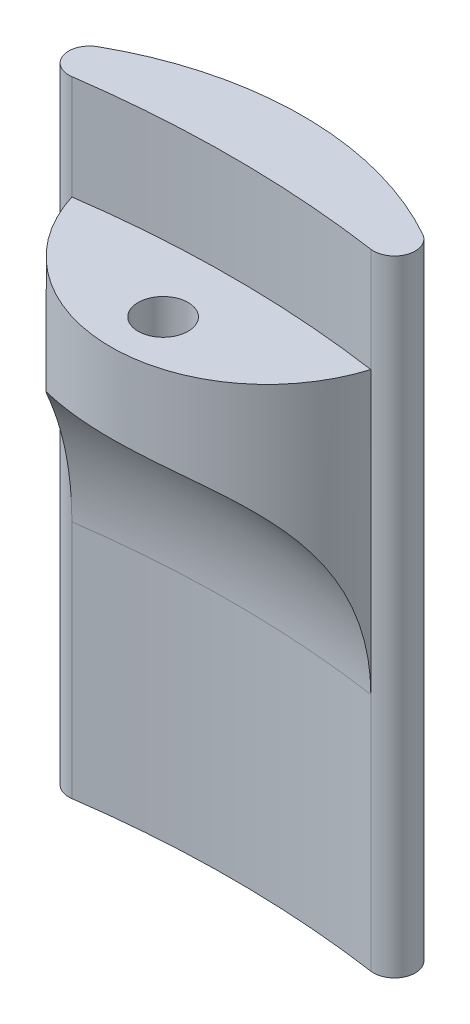
from build123d import *

# Parameters (mm, degrees)
BOSS_EXTRUDE1_DEPTH      = 10
BOSS_EXTRUDE1_DEPTH_BACK = 50
FILLET1_R                = 2
BOSS_EXTRUDE2_START      = -5
SKETCH3_R                = 2.4
BOSS_EXTRUDE2_DEPTH      = 5
FILLET2_R                = 22


with BuildPart() as part:
    # Sketch2 → Boss-Extrude1 (new, two sides: drawn at the far end of the back side and taken through both)
    with BuildSketch(Plane(origin=(0, 0, 0), x_dir=(1, 0, 0), z_dir=(0, 1, 0)).offset(-BOSS_EXTRUDE1_DEPTH_BACK)):
        with BuildLine():
            ThreePointArc((-22.5, 98.49115601), (0, 101.0285), (22.5, 98.49115601))
            ThreePointArc((22.5, 98.49115601), (0, 107.821909931), (-22.5, 98.49115601))
        make_face()
    extrude(amount=BOSS_EXTRUDE1_DEPTH + BOSS_EXTRUDE1_DEPTH_BACK)

    # Fillet1
    fillet1_edges = [part.edges().sort_by_distance(p)[0] for p in [
        (22.5, -20, -98.49115601),
        (-22.5, -20, -98.49115601),
    ]]
    fillet(fillet1_edges, radius=FILLET1_R)

    # Sketch3 → Boss-Extrude2 (add)
    with BuildSketch(Plane(origin=(0, 0, 0), x_dir=(1, 0, 0), z_dir=(0, 1, 0)).offset(BOSS_EXTRUDE2_START)):
        with BuildLine():
            ThreePointArc((14.341382747, 100.005412619), (0, 101.0285), (-14.341382747, 100.005412619))
            ThreePointArc((-14.341382747, 100.005412619), (0, 89.401404079), (14.341382747, 100.005412619))
        make_face()
        with Locations(Location((0, 94.415, 0), (0, 0, 270))):
            Circle(SKETCH3_R, mode=Mode.SUBTRACT)
    extrude(amount=BOSS_EXTRUDE2_DEPTH)

    # Fillet2
    # the kernel refuses this fillet: 22 mm, written as the material it adds along each edge
    with BuildSketch(Plane(origin=(0, -5, 0), x_dir=(0.6340991791841111, 0, -0.7732517254801548), z_dir=(0.7732517254801548, 0, 0.6340991791841111))) as fillet2_piece_1_section:
        with BuildLine():
            CenterArc((101.0285 - FILLET2_R, -FILLET2_R), FILLET2_R, 0, 90)
            Line((101.0285 - FILLET2_R, 0), (101.0285, 0))
            Line((101.0285, 0), (101.0285, -FILLET2_R))
        make_face()
    fillet2_piece_1 = revolve(axis=Axis((0, -5, 0), (0, 1, 0)), revolution_arc=78.706408495, mode=Mode.PRIVATE)
    fillet2_piece_1 = fillet2_piece_1 & Plane(origin=(0, -11.179397571, -104.401404079), x_dir=(-0.9560921831070281, 0, 0.29306609732556405), z_dir=(0, -1, 0)) * Cylinder(15, 405, mode=Mode.PRIVATE)
    fillet2_piece_1 = fillet2_piece_1 - Plane(origin=(0, -11.179397571, -94.415), x_dir=(0, 0, 1), z_dir=(0, -1, 0)) * Cylinder(2.4, 405, mode=Mode.PRIVATE)
    add(fillet2_piece_1)


solid = part.part
